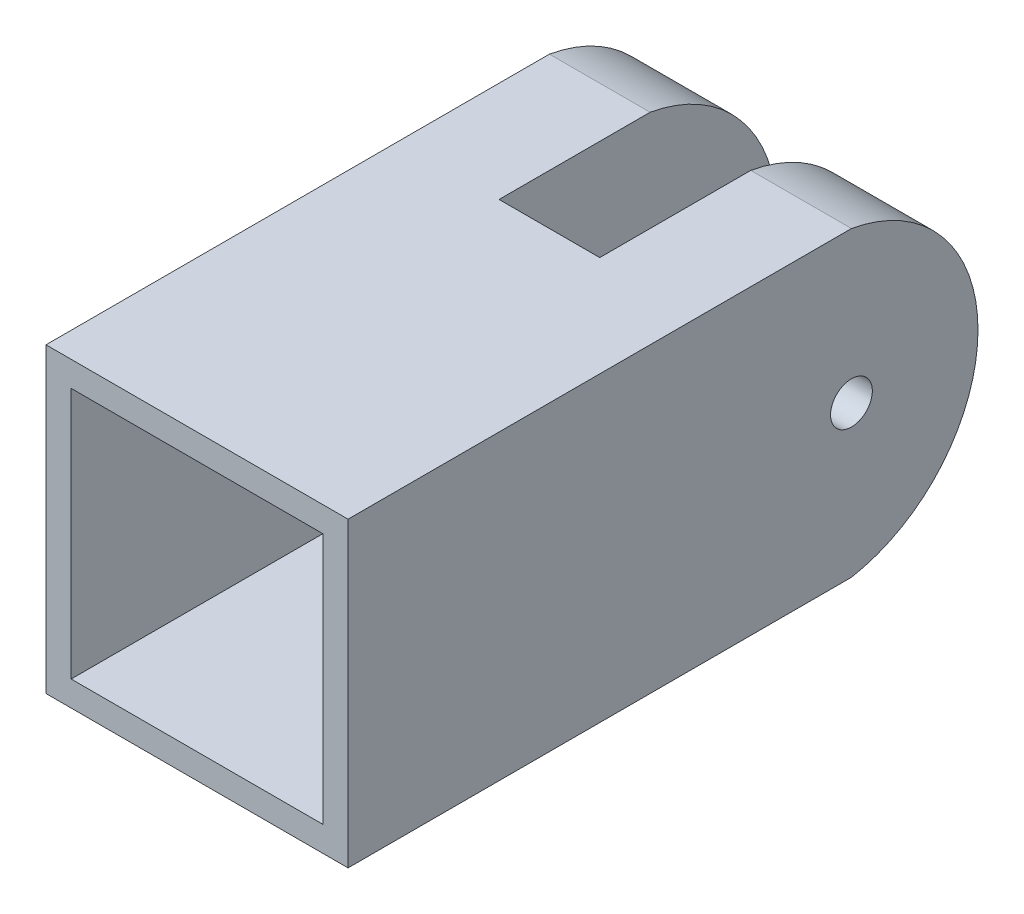
from build123d import *

# Parameters (mm, degrees)
SKETCH2_W           = 60
SKETCH2_H           = 60
BOSS_EXTRUDE1_DEPTH = 70
SKETCH3_W           = 20
SKETCH3_H           = 60
BOSS_EXTRUDE2_DEPTH = 30
BOSS_EXTRUDE3_DEPTH = 20
BOSS_EXTRUDE4_START = -20
BOSS_EXTRUDE4_DEPTH = 20
SKETCH6_W           = 50
SKETCH6_H           = 50
CUT_EXTRUDE1_DEPTH  = 67
SKETCH7_R           = 4.15
CUT_EXTRUDE2_DEPTH  = 87.02325267
SKETCH9_R           = 4.15
CUT_EXTRUDE3_DEPTH  = 87.02325267


with BuildPart() as part:
    # Sketch2 → Boss-Extrude1 (new body)
    with BuildSketch(Plane.XY):
        Rectangle(SKETCH2_W, SKETCH2_H)
    extrude(amount=BOSS_EXTRUDE1_DEPTH)

    # Sketch3 → Boss-Extrude2 (add)
    with BuildSketch(Plane(origin=(0, 0, 0), x_dir=(-1, 0, 0), z_dir=(0, 0, -1))):
        with Locations((20, 0)):
            Rectangle(SKETCH3_W, SKETCH3_H)
        with Locations((-20, 0)):
            Rectangle(SKETCH3_W, SKETCH3_H)
    extrude(amount=BOSS_EXTRUDE2_DEPTH)

    # Sketch4 → Boss-Extrude3 (add)
    with BuildSketch(Plane.ZY.offset(30)):
        with BuildLine():
            Line((-30, -30), (-30, 30))
            ThreePointArc((-30, 30), (-55.138874415, 0), (-30, -30))
        make_face()
    extrude(amount=-BOSS_EXTRUDE3_DEPTH)

    # Sketch5 → Boss-Extrude4 (add)
    with BuildSketch(Plane(origin=(30, 0, 0), x_dir=(0, 0, -1), z_dir=(1, 0, 0)).offset(BOSS_EXTRUDE4_START)):
        with BuildLine():
            Line((30, 30), (30, -30))
            ThreePointArc((30, -30), (55.138874415, 0), (30, 30))
        make_face()
    extrude(amount=BOSS_EXTRUDE4_DEPTH)

    # Sketch6 → Cut-Extrude1 (cut)
    with BuildSketch(Plane.XY.offset(70)):
        Rectangle(SKETCH6_W, SKETCH6_H)
    extrude(amount=-CUT_EXTRUDE1_DEPTH, mode=Mode.SUBTRACT)

    # Sketch7 → Cut-Extrude2 (cut, through all)
    with BuildSketch(Plane.ZY.offset(-10)):
        with Locations((-30, 0)):
            Circle(SKETCH7_R)
    extrude(amount=-CUT_EXTRUDE2_DEPTH, mode=Mode.SUBTRACT)

    # Sketch9 → Cut-Extrude3 (cut, through all)
    with BuildSketch(Plane(origin=(-10, 0, 0), x_dir=(0, 0, -1), z_dir=(1, 0, 0))):
        with Locations((30, 0)):
            Circle(SKETCH9_R)
    extrude(amount=-CUT_EXTRUDE3_DEPTH, mode=Mode.SUBTRACT)


solid = part.part
